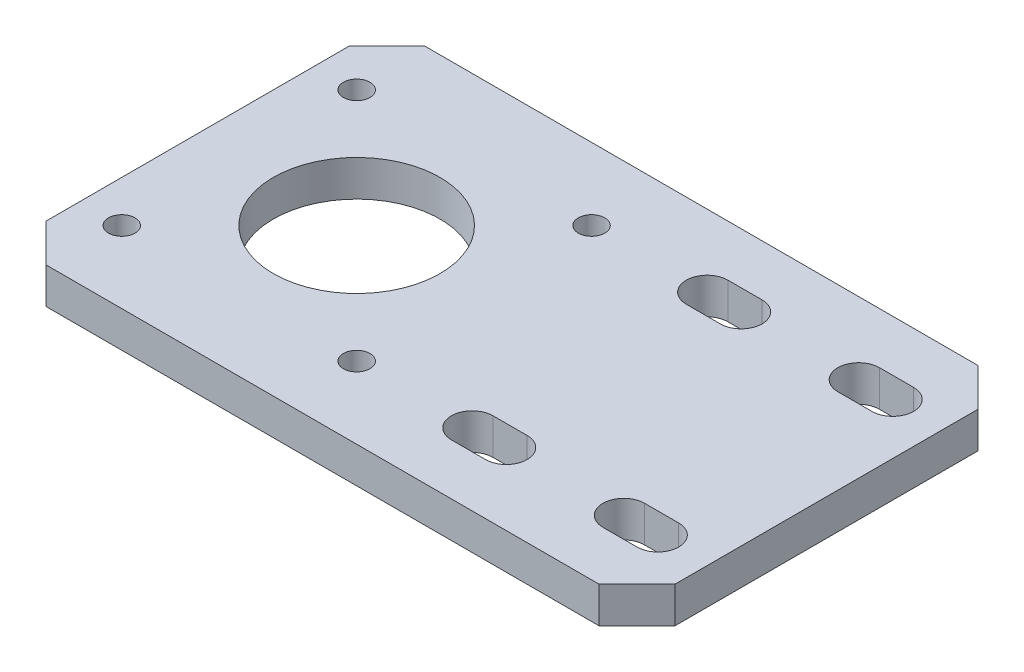
from build123d import *

# Parameters (mm, degrees)
SKETCH1_W                = 83
SKETCH1_H                = 50
BOSS_EXTRUDE1_DEPTH      = 4.7625
SKETCH2_R                = 11
SKETCH2_R_2              = 1.75
CUT_EXTRUDE1_DEPTH       = 98.013820697
CHAMFER1_SIZE            = 5
M5_CLEARANCE_SLOT1_DEPTH = 4.7625


# Read off the part's stored shape, not the designer's step: M5 Clearance Slot1
with BuildPart() as part:
    # Sketch1 → Boss-Extrude1 (new body)
    with BuildSketch(Plane(origin=(0, 0, 0), x_dir=(1, 0, 0), z_dir=(0, 1, 0))):
        with Locations((41.5, 25)):
            Rectangle(SKETCH1_W, SKETCH1_H)
    extrude(amount=BOSS_EXTRUDE1_DEPTH)

    # Sketch2 → Cut-Extrude1 (cut, through all)
    with BuildSketch(Plane(origin=(0, 4.7625, 0), x_dir=(1, 0, 0), z_dir=(0, 1, 0))):
        with Locations(Location((21, 25, 0), (0, 0, 270))):
            Circle(SKETCH2_R)
        with Locations(Location((5.5, 9.5, 0), (0, 0, 270))):
            Circle(SKETCH2_R_2)
        with Locations(Location((36.5, 9.5, 0), (0, 0, 270))):
            Circle(SKETCH2_R_2)
        with Locations(Location((36.5, 40.5, 0), (0, 0, 270))):
            Circle(SKETCH2_R_2)
        with Locations(Location((5.5, 40.5, 0), (0, 0, 270))):
            Circle(SKETCH2_R_2)
    extrude(amount=-CUT_EXTRUDE1_DEPTH, mode=Mode.SUBTRACT)

    # Chamfer1
    chamfer1_edges = [part.edges().sort_by_distance(p)[0] for p in [
        (0, 2.38125, -50),
        (83, 2.38125, -50),
        (83, 2.38125, 0),
        (0, 2.38125, 0),
    ]]
    chamfer(chamfer1_edges, length=CHAMFER1_SIZE)

    # M5 Clearance Slot1 outline → M5 Clearance Slot1 (cut)
    with BuildSketch(Plane(origin=(0, 0, 0), x_dir=(1, 0, 0), z_dir=(0, 1, 0))):
        with BuildLine():
            Line((51.75, 6.75), (56.25, 6.75))
            ThreePointArc((56.25, 6.75), (59, 9.5), (56.25, 12.25))
            Line((56.25, 12.25), (51.75, 12.25))
            ThreePointArc((51.75, 12.25), (49, 9.5), (51.75, 6.75))
        make_face()
        with BuildLine():
            ThreePointArc((76.25, 6.75), (79, 9.5), (76.25, 12.25))
            Line((76.25, 12.25), (71.75, 12.25))
            ThreePointArc((71.75, 12.25), (69, 9.5), (71.75, 6.75))
            Line((71.75, 6.75), (76.25, 6.75))
        make_face()
        with BuildLine():
            Line((71.75, 37.75), (76.25, 37.75))
            ThreePointArc((76.25, 37.75), (79, 40.5), (76.25, 43.25))
            Line((76.25, 43.25), (71.75, 43.25))
            ThreePointArc((71.75, 43.25), (69, 40.5), (71.75, 37.75))
        make_face()
        with BuildLine():
            ThreePointArc((56.25, 37.75), (59, 40.5), (56.25, 43.25))
            Line((56.25, 43.25), (51.75, 43.25))
            ThreePointArc((51.75, 43.25), (49, 40.5), (51.75, 37.75))
            Line((51.75, 37.75), (56.25, 37.75))
        make_face()
    extrude(amount=M5_CLEARANCE_SLOT1_DEPTH, mode=Mode.SUBTRACT)


solid = part.part
